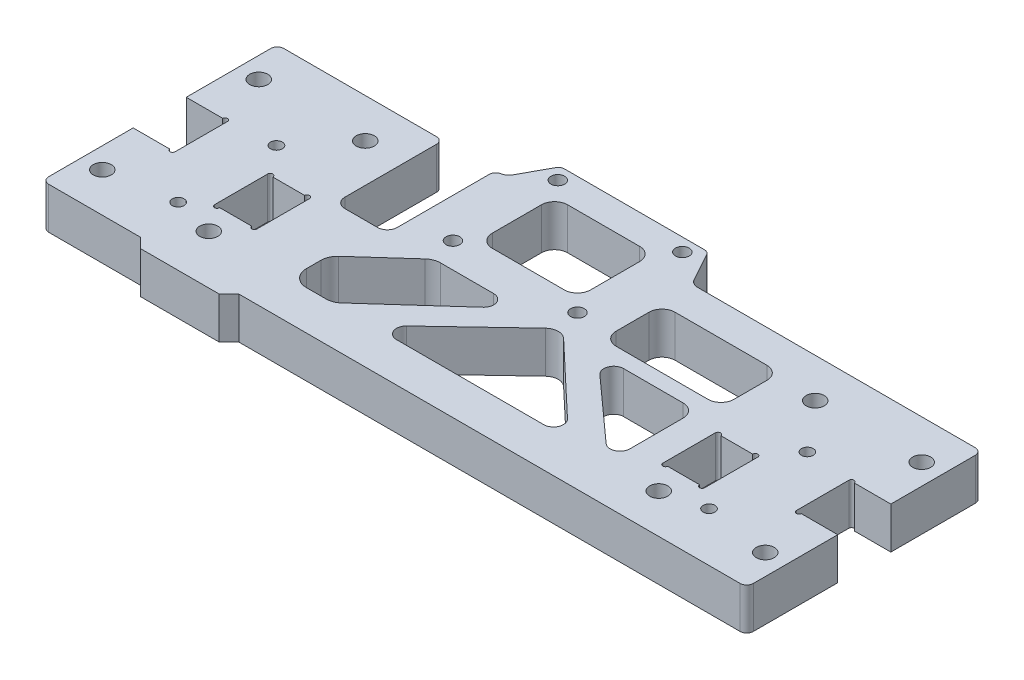
from build123d import *

# Parameters (mm, degrees)
SKETCH1_R           = 2.75
BOSS_EXTRUDE1_DEPTH = 12.7
SKETCH2_W           = 16
SKETCH2_H           = 46.496113018
CUT_EXTRUDE1_DEPTH  = 231.724624824
SKETCH3_R           = 2.1
CUT_EXTRUDE2_DEPTH  = 231.724624824
CUT_EXTRUDE3_DEPTH  = 231.724624824
FILLET1_R           = 3
FILLET2_R           = 2
SKETCH6_R           = 1.8
CUT_EXTRUDE4_DEPTH  = 231.724624958


with BuildPart() as part:
    # Sketch1 → Boss-Extrude1 (new body)
    with BuildSketch(Plane(origin=(0, 0, 0), x_dir=(1, 0, 0), z_dir=(0, 1, 0))):
        with BuildLine():
            Line((0, 71.75), (69.5, 71.75))
            Line((69.5, 71.75), (75.5, 82.75))
            Line((75.5, 82.75), (120.5, 82.75))
            Line((120.5, 82.75), (126.5, 71.75))
            Line((126.5, 71.75), (215, 71.75))
            Line((215, 71.75), (215, 43.975))
            Line((215, 43.975), (203.881088693, 43.975))
            ThreePointArc((203.881088693, 43.975), (203.090544346, 44.652363805), (202.3, 43.975))
            Line((202.3, 43.975), (202.3, 27.775))
            ThreePointArc((202.3, 27.775), (203.090544346, 27.097636195), (203.881088693, 27.775))
            Line((203.881088693, 27.775), (215, 27.775))
            Line((215, 27.775), (215, 0))
            Line((215, 0), (60, 0))
            Line((60, 0), (57, -3))
            Line((57, -3), (33, -3))
            Line((33, -3), (30, 0))
            Line((30, 0), (0, 0))
            Line((0, 0), (0, 27.775))
            Line((0, 27.775), (11.118911307, 27.775))
            ThreePointArc((11.118911307, 27.775), (11.909455654, 27.097636195), (12.7, 27.775))
            Line((12.7, 27.775), (12.7, 43.975))
            ThreePointArc((12.7, 43.975), (11.909455654, 44.652363805), (11.118911307, 43.975))
            Line((11.118911307, 43.975), (0, 43.975))
            Line((0, 43.975), (0, 71.75))
        make_face()
        with Locations((38.85, 59.75)):
            Circle(SKETCH1_R, mode=Mode.SUBTRACT)
        with Locations((38.85, 12)):
            Circle(SKETCH1_R, mode=Mode.SUBTRACT)
        with Locations((176.15, 59.75)):
            Circle(SKETCH1_R, mode=Mode.SUBTRACT)
        with Locations((176.15, 12)):
            Circle(SKETCH1_R, mode=Mode.SUBTRACT)
        with Locations((6.35, 12)):
            Circle(SKETCH1_R, mode=Mode.SUBTRACT)
        with Locations((6.35, 59.75)):
            Circle(SKETCH1_R, mode=Mode.SUBTRACT)
        with Locations((208.65, 59.75)):
            Circle(SKETCH1_R, mode=Mode.SUBTRACT)
        with Locations((208.65, 12)):
            Circle(SKETCH1_R, mode=Mode.SUBTRACT)
        with BuildLine():
            Line((32.700387603, 36.1), (32.700387603, 19.9))
            ThreePointArc((32.700387603, 19.9), (33.500387603, 19.1), (34.300387603, 19.9))
            Line((34.300387603, 19.9), (44.006274607, 19.9))
            ThreePointArc((44.006274607, 19.9), (44.85009833, 19.201570193), (45.6, 20))
            Line((45.6, 20), (45.6, 36))
            ThreePointArc((45.6, 36), (44.85009833, 36.798429807), (44.006274607, 36.1))
            Line((44.006274607, 36.1), (34.300387603, 36.1))
            ThreePointArc((34.300387603, 36.1), (33.500387603, 36.9), (32.700387603, 36.1))
        make_face(mode=Mode.SUBTRACT)
        with BuildLine():
            Line((182.299612397, 36.1), (182.299612397, 19.9))
            ThreePointArc((182.299612397, 19.9), (181.499612397, 19.1), (180.699612397, 19.9))
            Line((180.699612397, 19.9), (170.993725393, 19.9))
            ThreePointArc((170.993725393, 19.9), (170.14990167, 19.201570193), (169.4, 20))
            Line((169.4, 20), (169.4, 36))
            ThreePointArc((169.4, 36), (170.14990167, 36.798429807), (170.993725393, 36.1))
            Line((170.993725393, 36.1), (180.699612397, 36.1))
            ThreePointArc((180.699612397, 36.1), (181.499612397, 36.9), (182.299612397, 36.1))
        make_face(mode=Mode.SUBTRACT)
    extrude(amount=BOSS_EXTRUDE1_DEPTH)

    # Sketch2 → Cut-Extrude1 (cut, through all)
    with BuildSketch(Plane(origin=(0, 12.7, 0), x_dir=(1, 0, 0), z_dir=(0, 1, 0))):
        with Locations((58.6, 61.998056509)):
            Rectangle(SKETCH2_W, SKETCH2_H)
    extrude(amount=-CUT_EXTRUDE1_DEPTH, mode=Mode.SUBTRACT)

    # Sketch3 → Cut-Extrude2 (cut, through all)
    with BuildSketch(Plane(origin=(0, 12.7, 0), x_dir=(1, 0, 0), z_dir=(0, 1, 0))):
        with Locations((78.6, 78.75)):
            Circle(SKETCH3_R)
        with Locations((78.6, 46.75)):
            Circle(SKETCH3_R)
        with Locations((116.6, 78.75)):
            Circle(SKETCH3_R)
        with Locations((116.6, 46.75)):
            Circle(SKETCH3_R)
    extrude(amount=-CUT_EXTRUDE2_DEPTH, mode=Mode.SUBTRACT)

    # Sketch5 → Cut-Extrude3 (cut, through all)
    with BuildSketch(Plane(origin=(0, 12.7, 0), x_dir=(1, 0, 0), z_dir=(0, 1, 0))):
        with BuildLine():
            Line((98.782125318, 39), (82.518680026, 39))
            ThreePointArc((82.518680026, 39), (80.72736119, 38.668102058), (79.173856368, 37.716470731))
            Line((79.173856368, 37.716470731), (65.279045214, 25.211140692))
            ThreePointArc((65.279045214, 25.211140692), (64.056368555, 23.528862886), (63.623868872, 21.494669961))
            Line((63.623868872, 21.494669961), (63.623868872, 17))
            ThreePointArc((63.623868872, 17), (65.088334966, 13.464466094), (68.623868872, 12))
            Line((68.623868872, 12), (74.681319974, 12))
            ThreePointArc((74.681319974, 12), (76.47263881, 12.331897942), (78.026143632, 13.283529269))
            Line((78.026143632, 13.283529269), (100.789019513, 33.770117561))
            ThreePointArc((100.789019513, 33.770117561), (101.582986553, 37.074791302), (98.782125318, 39))
        make_face()
        with BuildLine():
            Line((115.851322474, 37.77611222), (94.075922745, 17.179491723))
            ThreePointArc((94.075922745, 17.179491723), (93.350095678, 13.890602679), (96.13743089, 12))
            Line((96.13743089, 12), (141.06256911, 12))
            ThreePointArc((141.06256911, 12), (143.849904322, 13.890602679), (143.124077255, 17.179491723))
            Line((143.124077255, 17.179491723), (121.348677526, 37.77611222))
            ThreePointArc((121.348677526, 37.77611222), (118.6, 38.870123257), (115.851322474, 37.77611222))
        make_face()
        with BuildLine():
            Line((138.417874682, 39), (156.6, 39))
            ThreePointArc((156.6, 39), (159.428427125, 37.828427125), (160.6, 35))
            Line((160.6, 35), (160.6, 18.736087214))
            ThreePointArc((160.6, 18.736087214), (158.820515755, 15.995587024), (155.593105805, 16.506204775))
            Line((155.593105805, 16.506204775), (136.410980487, 33.770117561))
            ThreePointArc((136.410980487, 33.770117561), (135.617013447, 37.074791302), (138.417874682, 39))
        make_face()
        with BuildLine():
            Line((86.6, 73.75), (108.6, 73.75))
            ThreePointArc((108.6, 73.75), (111.428427125, 72.578427125), (112.6, 69.75))
            Line((112.6, 69.75), (112.6, 54.75))
            ThreePointArc((112.6, 54.75), (111.428427125, 51.921572875), (108.6, 50.75))
            Line((108.6, 50.75), (86.6, 50.75))
            ThreePointArc((86.6, 50.75), (83.771572875, 51.921572875), (82.6, 54.75))
            Line((82.6, 54.75), (82.6, 69.75))
            ThreePointArc((82.6, 69.75), (83.771572875, 72.578427125), (86.6, 73.75))
        make_face()
        with BuildLine():
            Line((131.4, 61.75), (159.4, 61.75))
            ThreePointArc((159.4, 61.75), (162.228427125, 60.578427125), (163.4, 57.75))
            Line((163.4, 57.75), (163.4, 47.75))
            ThreePointArc((163.4, 47.75), (162.228427125, 44.921572875), (159.4, 43.75))
            Line((159.4, 43.75), (131.4, 43.75))
            ThreePointArc((131.4, 43.75), (128.571572875, 44.921572875), (127.4, 47.75))
            Line((127.4, 47.75), (127.4, 57.75))
            ThreePointArc((127.4, 57.75), (128.571572875, 60.578427125), (131.4, 61.75))
        make_face()
    extrude(amount=-CUT_EXTRUDE3_DEPTH, mode=Mode.SUBTRACT)

    # Fillet1
    fillet1_edges = [part.edges().sort_by_distance(p)[0] for p in [
        (69.5, 6.35, -71.75),
        (66.6, 6.35, -38.75),
        (50.6, 6.35, -38.75),
        (126.5, 6.35, -71.75),
    ]]
    fillet(fillet1_edges, radius=FILLET1_R)

    # Fillet2
    fillet2_edges = [part.edges().sort_by_distance(p)[0] for p in [
        (215, 6.35, -71.75),
        (120.5, 6.35, -82.75),
        (75.5, 6.35, -82.75),
        (50.6, 6.35, -71.75),
        (66.6, 6.35, -71.75),
        (0, 6.35, -71.75),
        (215, 6.35, 0),
        (0, 6.35, 0),
    ]]
    fillet(fillet2_edges, radius=FILLET2_R)

    # Sketch6 → Cut-Extrude4 (cut, through all)
    with BuildSketch(Plane(origin=(0, 12.7, 0), x_dir=(1, 0, 0), z_dir=(0, 1, 0))):
        with Locations((188.5, 45)):
            Circle(SKETCH6_R)
        with Locations((188.5, 15)):
            Circle(SKETCH6_R)
        with Locations((26.5, 45)):
            Circle(SKETCH6_R)
        with Locations((26.5, 15)):
            Circle(SKETCH6_R)
    extrude(amount=-CUT_EXTRUDE4_DEPTH, mode=Mode.SUBTRACT)


solid = part.part
